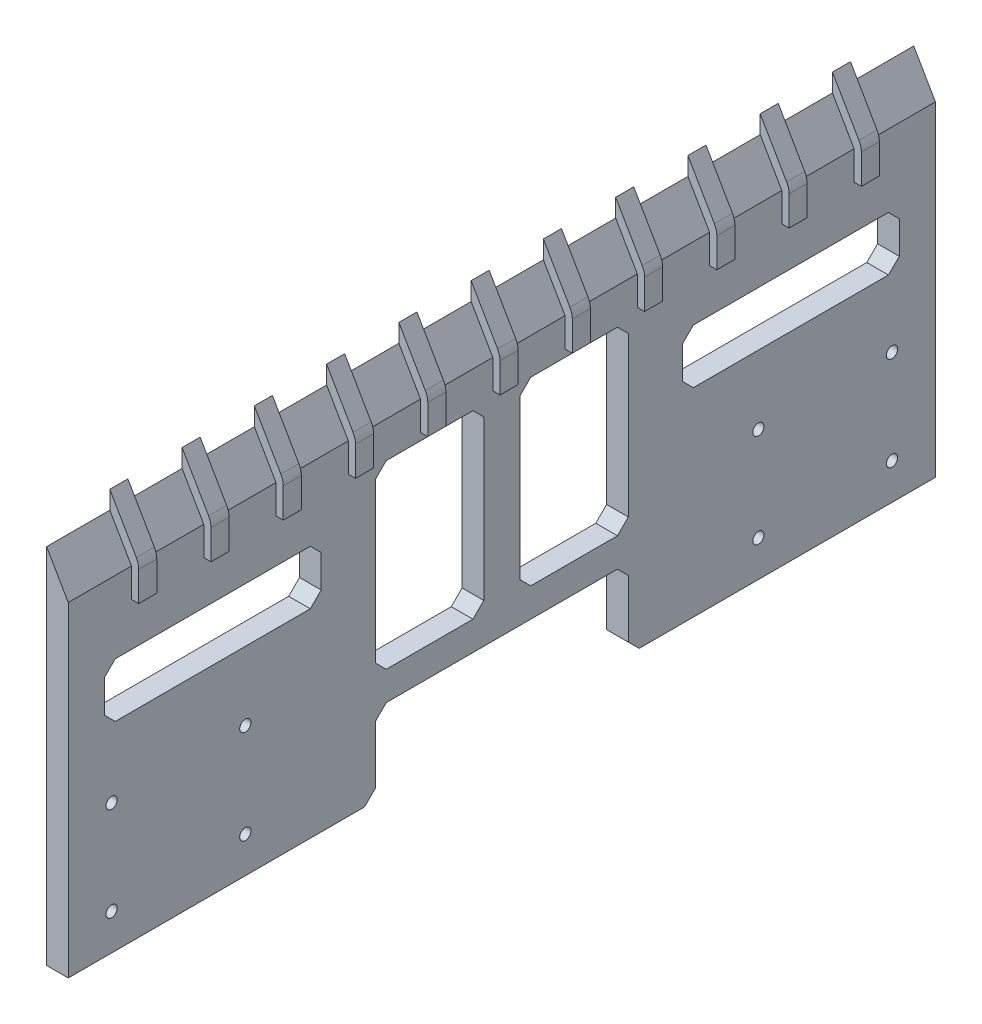
from build123d import *

# Parameters (mm, degrees)
SKETCH_1_W                  = 240
SKETCH_1_H                  = 90
EXTRUDE_1_DEPTH             = 6
SKETCH_2_R                  = 1.55
CUT_EXTRUDE_1_DEPTH         = 257.390327431
SKETCH_3_W                  = 60
SKETCH_3_H                  = 15
CUT_EXTRUDE_2_DEPTH         = 257.390327431
SKETCH_4_W                  = 30
SKETCH_4_H                  = 50
CUT_EXTRUDE_3_DEPTH         = 257.390327431
SKETCH_8_W                  = 70
SKETCH_8_H                  = 22
CUT_EXTRUDE_5_DEPTH         = 257.390327431
SKETCH_5_R                  = 3
CUT_EXTRUDE_4_DEPTH         = 3
EXTRUDE_2_DEPTH             = 240
EXTRUDE_3_DEPTH             = 5
PATTERN_LINEAR_5_COUNT      = 6
PATTERN_LINEAR_5_PITCH      = 20
PATTERN_LINEAR_5_COUNT_DIR2 = 6
PATTERN_LINEAR_5_PITCH_DIR2 = 20
FILLET_5_R                  = 5
CHAMFER_1_SIZE              = 3


with BuildPart() as part:
    # 草图1 → 凸台-拉伸1 (new body)
    with BuildSketch(Plane(origin=(0, 0, 0), x_dir=(0, 0, -1), z_dir=(1, 0, 0))):
        with Locations((120, -45)):
            Rectangle(SKETCH_1_W, SKETCH_1_H)
    extrude(amount=EXTRUDE_1_DEPTH)

    # 草图2 → 切除-拉伸1 (cut, through all)
    with BuildSketch(Plane(origin=(6, 0, 0), x_dir=(0, 0, -1), z_dir=(1, 0, 0))):
        with Locations((12, -54)):
            Circle(SKETCH_2_R)
        with Locations((49, -80)):
            Circle(SKETCH_2_R)
        with Locations((49, -54)):
            Circle(SKETCH_2_R)
        with Locations((12, -80)):
            Circle(SKETCH_2_R)
        with Locations((228, -80)):
            Circle(SKETCH_2_R)
        with Locations((191, -54)):
            Circle(SKETCH_2_R)
        with Locations((191, -80)):
            Circle(SKETCH_2_R)
        with Locations((228, -54)):
            Circle(SKETCH_2_R)
    extrude(amount=-CUT_EXTRUDE_1_DEPTH, mode=Mode.SUBTRACT)

    # 草图3 → 切除-拉伸2 (cut, through all)
    with BuildSketch(Plane(origin=(6, 0, 0), x_dir=(0, 0, -1), z_dir=(1, 0, 0))):
        with Locations((40, -27.5)):
            Rectangle(SKETCH_3_W, SKETCH_3_H)
        with Locations((200, -27.5)):
            Rectangle(SKETCH_3_W, SKETCH_3_H)
    extrude(amount=-CUT_EXTRUDE_2_DEPTH, mode=Mode.SUBTRACT)

    # 草图4 → 切除-拉伸3 (cut, through all)
    with BuildSketch(Plane(origin=(6, 0, 0), x_dir=(0, 0, -1), z_dir=(1, 0, 0))):
        with Locations((100, -35)):
            Rectangle(SKETCH_4_W, SKETCH_4_H)
        with Locations((140, -35)):
            Rectangle(SKETCH_4_W, SKETCH_4_H)
    extrude(amount=-CUT_EXTRUDE_3_DEPTH, mode=Mode.SUBTRACT)

    # 草图8 → 切除-拉伸5 (cut, through all)
    with BuildSketch(Plane(origin=(6, 0, 0), x_dir=(0, 0, -1), z_dir=(1, 0, 0))):
        with Locations((120, -79)):
            Rectangle(SKETCH_8_W, SKETCH_8_H)
    extrude(amount=-CUT_EXTRUDE_5_DEPTH, mode=Mode.SUBTRACT)

    # 草图5 → 切除-拉伸4 (cut)
    with BuildSketch(Plane.ZY):
        with Locations((-191, -80)):
            Circle(SKETCH_5_R)
        with Locations((-228, -80)):
            Circle(SKETCH_5_R)
        with Locations((-191, -54)):
            Circle(SKETCH_5_R)
        with Locations((-228, -54)):
            Circle(SKETCH_5_R)
        with Locations((-45, -80)):
            Circle(SKETCH_5_R)
        with Locations((-12, -80)):
            Circle(SKETCH_5_R)
        with Locations((-12, -54)):
            Circle(SKETCH_5_R)
        with Locations((-49, -54)):
            Circle(SKETCH_5_R)
    extrude(amount=-CUT_EXTRUDE_4_DEPTH, mode=Mode.SUBTRACT)

    # 草图6 → 凸台-拉伸2 (add)
    with BuildSketch(Plane.XY):
        Polygon((6, 0), (0, 0), (0, 10.392304845), align=None)
    extrude(amount=-EXTRUDE_2_DEPTH)

    # 草图7 → 凸台-拉伸3 (add)
    with BuildSketch(Plane.XY.offset(-117.5)):
        Polygon((0, 10.392304845), (0, 15.392304845), (8, 1.535898385), (8, -8), (6, -8), (6, 0), align=None)
    extrude_3 = extrude(amount=-EXTRUDE_3_DEPTH)

    # 阵列(线性)5: Extrude 3 6 × 6
    with Locations(*[Vector(0, 0, 1) * (i * PATTERN_LINEAR_5_PITCH) + Vector(0, 0, -1) * (j * PATTERN_LINEAR_5_PITCH_DIR2) for i in range(PATTERN_LINEAR_5_COUNT) for j in range(PATTERN_LINEAR_5_COUNT_DIR2) if (i, j) != (0, 0)]):
        add(extrude_3)

    # 圆角5
    fillet_5_edges = [part.edges().sort_by_distance(p)[0] for p in [
        (8, 1.535898385, -20),
        (8, 1.535898385, -40),
        (8, 1.535898385, -60),
        (8, 1.535898385, -80),
        (8, 1.535898385, -100),
        (8, 1.535898385, -120),
        (8, 1.535898385, -140),
        (8, 1.535898385, -160),
        (8, 1.535898385, -180),
        (8, 1.535898385, -200),
        (8, 1.535898385, -220),
    ]]
    fillet(fillet_5_edges, radius=FILLET_5_R)

    # 倒角1
    chamfer_1_edges = [part.edges().sort_by_distance(p)[0] for p in [
        (3, -60, -85),
        (3, -60, -125),
        (3, -35, -170),
        (3, -35, -230),
        (3, -60, -155),
        (3, -60, -115),
        (3, -20, -230),
        (3, -10, -155),
        (3, -10, -115),
        (3, -20, -170),
        (3, -10, -125),
        (3, -10, -85),
        (3, -35, -70),
        (3, -20, -70),
        (3, -35, -10),
        (3, -20, -10),
        (3, -68, -155),
        (3, -68, -85),
        (3, -90, -155),
        (3, -90, -85),
    ]]
    chamfer(chamfer_1_edges, length=CHAMFER_1_SIZE)


solid = part.part
